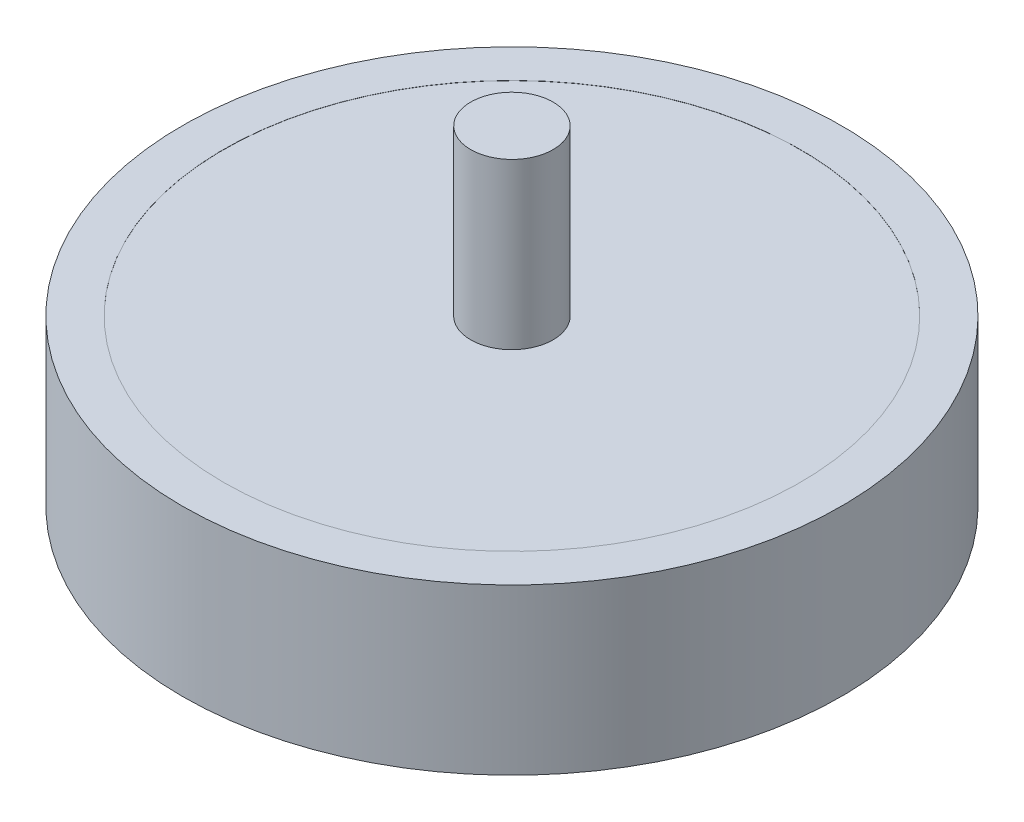
from build123d import *

# Parameters (mm, degrees)
SKETCH1_R           = 20
SKETCH1_R_2         = 17.5
BOSS_EXTRUDE1_DEPTH = 10
SKETCH2_R           = 17.5
BOSS_EXTRUDE3_DEPTH = 9.99
SKETCH4_R           = 2.5
BOSS_EXTRUDE4_DEPTH = 10
SKETCH3_R           = 2.5
CUT_EXTRUDE2_DEPTH  = 5


with BuildPart() as part:
    # Sketch1 → Boss-Extrude1 (new body)
    with BuildSketch(Plane(origin=(0, 0, 0), x_dir=(1, 0, 0), z_dir=(0, 1, 0))):
        Circle(SKETCH1_R)
        Circle(SKETCH1_R_2, mode=Mode.SUBTRACT)
    extrude(amount=BOSS_EXTRUDE1_DEPTH)



with BuildPart() as body_2:
    # Sketch2 → Boss-Extrude3 (new body)
    with BuildSketch(Plane(origin=(0, 0, 0), x_dir=(1, 0, 0), z_dir=(0, 1, 0))):
        Circle(SKETCH2_R)
    extrude(amount=BOSS_EXTRUDE3_DEPTH)


with BuildPart() as part_1:
    add(part.part)

    add(body_2.part)  # Boss-Extrude4 merges body 2
    # Sketch4 → Boss-Extrude4 (add)
    with BuildSketch(Plane(origin=(0, 9.99, 0), x_dir=(1, 0, 0), z_dir=(0, 1, 0))):
        Circle(SKETCH4_R)
    extrude(amount=BOSS_EXTRUDE4_DEPTH)

    # Sketch3 → Cut-Extrude2 (cut)
    with BuildSketch(Plane.XZ):
        Circle(SKETCH3_R)
    extrude(amount=-CUT_EXTRUDE2_DEPTH, mode=Mode.SUBTRACT)


solid = part_1.part
